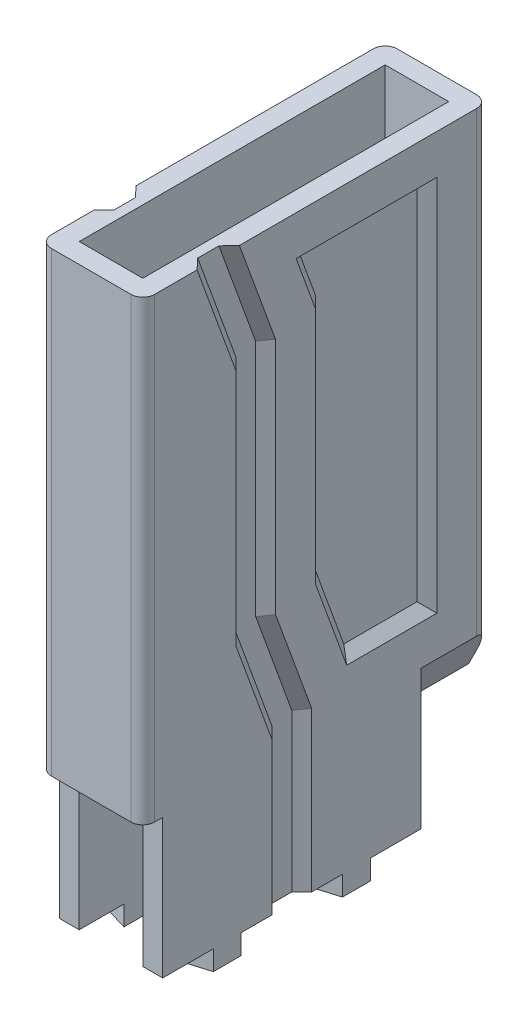
from build123d import *

# Parameters (mm, degrees)
BOSS_EXTRUDE1_DEPTH      = 5
BOSS_EXTRUDE1_2_DEPTH    = 5
BOSS_EXTRUDE1_3_DEPTH    = 5
BOSS_EXTRUDE1_4_DEPTH    = 5
SKETCH5_W                = 5
SKETCH5_H                = 65
BOSS_EXTRUDE6_DEPTH      = 150
SKETCH6_W                = 5
SKETCH6_H                = 125
BOSS_EXTRUDE7_DEPTH      = 12
SKETCH9_W                = 26
SKETCH9_H                = 125
BOSS_EXTRUDE9_DEPTH      = 5
SKETCH7_W                = 26
SKETCH7_H                = 115
BOSS_EXTRUDE8_DEPTH      = 5
CHAMFER1_SIZE            = 10
CHAMFER1_SIZE2           = 5
CHAMFER2_SIZE2           = 10
CHAMFER2_SIZE            = 5
FILLET1_R                = 3
CUT_EXTRUDE2_DEPTH       = 2.5
CUT_EXTRUDE3_DEPTH       = 2.5
CHAMFER3_SIZE            = 2.5
CHAMFER3_OF_MIRROR1_SIZE = 2.5


with BuildPart() as part:
    # Sketch1 → Boss-Extrude1 (new body)
    with BuildSketch(Plane(origin=(0, 0, 0), x_dir=(1, 0, 0), z_dir=(0, 1, 0))):
        Polygon((-13, 19.75), (-13, 12.75), (-8, 11.25), (-8, 21.25), align=None)
    extrude(amount=-BOSS_EXTRUDE1_DEPTH)



with BuildPart() as body_2:
    # Sketch1 → Boss-Extrude1 2 (new body)
    with BuildSketch(Plane(origin=(0, 0, 0), x_dir=(1, 0, 0), z_dir=(0, 1, 0))):
        Polygon((-13, -19.75), (-8, -21.25), (-8, -11.25), (-13, -12.75), align=None)
    extrude(amount=-BOSS_EXTRUDE1_2_DEPTH)


with BuildPart() as body_3:
    # Sketch1 → Boss-Extrude1 3 (new body)
    with BuildSketch(Plane(origin=(0, 0, 0), x_dir=(1, 0, 0), z_dir=(0, 1, 0))):
        Polygon((13, 19.75), (8, 21.25), (8, 11.25), (13, 12.75), align=None)
    extrude(amount=-BOSS_EXTRUDE1_3_DEPTH)


with BuildPart() as body_4:
    # Sketch1 → Boss-Extrude1 4 (new body)
    with BuildSketch(Plane(origin=(0, 0, 0), x_dir=(1, 0, 0), z_dir=(0, 1, 0))):
        Polygon((13, -19.75), (13, -12.75), (8, -11.25), (8, -21.25), align=None)
    extrude(amount=-BOSS_EXTRUDE1_4_DEPTH)


with BuildPart() as part_1:
    add(part.part)

    add(body_2.part)  # Boss-Extrude6 merges body 2

    add(body_3.part)  # Boss-Extrude6 merges body 3

    add(body_4.part)  # Boss-Extrude6 merges body 4
    # Sketch5 → Boss-Extrude6 (add)
    with BuildSketch(Plane(origin=(0, 0, 0), x_dir=(1, 0, 0), z_dir=(0, 1, 0))):
        with Locations((-10.5, 0)):
            Rectangle(SKETCH5_W, SKETCH5_H)
        with Locations((10.5, 0)):
            Rectangle(SKETCH5_W, SKETCH5_H)
    extrude(amount=BOSS_EXTRUDE6_DEPTH)

    # Sketch6 → Boss-Extrude7 (add)
    with BuildSketch(Plane(origin=(0, 0, -32.5), x_dir=(-1, 0, 0), z_dir=(0, 0, -1))):
        with Locations((-10.5, 87.5)):
            Rectangle(SKETCH6_W, SKETCH6_H)
        with Locations((10.5, 87.5)):
            Rectangle(SKETCH6_W, SKETCH6_H)
    extrude(amount=BOSS_EXTRUDE7_DEPTH)

    # Sketch9 → Boss-Extrude9 (add)
    with BuildSketch(Plane(origin=(0, 0, -44.5), x_dir=(-1, 0, 0), z_dir=(0, 0, -1))):
        with Locations((0, 87.5)):
            Rectangle(SKETCH9_W, SKETCH9_H)
    extrude(amount=BOSS_EXTRUDE9_DEPTH)

    # Sketch7 → Boss-Extrude8 (add)
    with BuildSketch(Plane.XY.offset(32.5)):
        with Locations((0, 92.5)):
            Rectangle(SKETCH7_W, SKETCH7_H)
    extrude(amount=BOSS_EXTRUDE8_DEPTH)

    # Chamfer1
    chamfer1_edges = [part_1.edges().sort_by_distance(p)[0] for p in [
        (13, 25, -41),
    ]]
    chamfer1_side = [part_1.faces().sort_by_distance(p)[0] for p in [
        (13, 77.49201278, -5.3514377),
    ]]
    chamfer(chamfer1_edges, length=CHAMFER1_SIZE, length2=CHAMFER1_SIZE2, reference=chamfer1_side[0])

    # Chamfer2
    chamfer2_edges = [part_1.edges().sort_by_distance(p)[0] for p in [
        (-13, 25, -41),
    ]]
    chamfer2_side = [part_1.faces().sort_by_distance(p)[0] for p in [
        (-12.9, 25, -41),
    ]]
    chamfer(chamfer2_edges, length=CHAMFER2_SIZE - 0.0001, length2=CHAMFER2_SIZE2 - 0.0001, reference=chamfer2_side[0])  # a hair under: the kernel refuses the full size

    # Fillet1
    fillet1_edges = [part_1.edges().sort_by_distance(p)[0] for p in [
        (-13, 92.49995, -49.5),
        (13, 92.5, -49.5),
        (13, 92.5, 37.5),
        (-13, 92.5, 37.5),
    ]]
    fillet(fillet1_edges, radius=FILLET1_R)

    # Sketch13 → Cut-Extrude2 (cut)
    with BuildSketch(Plane.ZY.offset(13)):
        Polygon((13.198511713, 150), (4.099255857, 125), (4.099255857, 65), (-5, 40), (-5, 0), (5, 0), (5, 38.236730193), (14.099255857, 63.236730193), (14.099255857, 123.236730193), (23.840289438, 150), align=None)
    cut_extrude2 = extrude(amount=-CUT_EXTRUDE2_DEPTH, mode=Mode.SUBTRACT)

    # Sketch15 → Cut-Extrude3 (cut)
    with BuildSketch(Plane.ZY.offset(13)):
        Polygon((-5.900744143, 66.763269807), (-13.821926553, 45), (-36.5, 45), (-36.5, 140), (-1.082968354, 140), (-5.900744143, 126.763269807), align=None)
    cut_extrude3 = extrude(amount=-CUT_EXTRUDE3_DEPTH, mode=Mode.SUBTRACT)

    # Chamfer3
    chamfer3_edges = [part_1.edges().sort_by_distance(p)[0] for p in [
        (-10.5, 136.618365096, 18.969772647),
        (-10.5, 93.236730193, 14.099255857),
        (-10.5, 50.736730193, 9.549627928),
        (-10.5, 19.118365096, 5),
        (-10.5, 20, -5),
        (-10.5, 52.5, -0.450372072),
        (-10.5, 95, 4.099255857),
        (-10.5, 137.5, 8.648883785),
        (-10.5, 45, -25.160963277),
        (-10.5, 55.881634904, -9.861335348),
        (-10.5, 96.763269807, -5.900744143),
        (-10.5, 133.381634904, -3.491856249),
        (-10.5, 92.5, -36.5),
        (-10.5, 140, -18.791484177),
    ]]
    chamfer(chamfer3_edges, length=CHAMFER3_SIZE - 0.0001)  # a hair under: the kernel refuses the full size

    # Mirror1: Cut-Extrude2, Cut-Extrude3 across plane
    add(cut_extrude2.mirror(Plane(origin=(0, 0, 0), x_dir=(0, 0, 1), z_dir=(1, 0, 0))), mode=Mode.SUBTRACT)
    add(cut_extrude3.mirror(Plane(origin=(0, 0, 0), x_dir=(0, 0, 1), z_dir=(1, 0, 0))), mode=Mode.SUBTRACT)

    # Chamfer3 of Mirror1
    chamfer3_of_mirror1_edges = [part_1.edges().sort_by_distance(p)[0] for p in [
        (10.5, 136.618365096, 18.969772647),
        (10.5, 93.236730193, 14.099255857),
        (10.5, 50.736730193, 9.549627928),
        (10.5, 19.118365096, 5),
        (10.5, 20, -5),
        (10.5, 52.5, -0.450372072),
        (10.5, 95, 4.099255857),
        (10.5, 137.5, 8.648883785),
        (10.5, 45, -25.160963277),
        (10.5, 55.881634904, -9.861335348),
        (10.5, 96.763269807, -5.900744143),
        (10.5, 133.381634904, -3.491856249),
        (10.5, 92.5, -36.5),
        (10.5, 140, -18.791484177),
    ]]
    chamfer(chamfer3_of_mirror1_edges, length=CHAMFER3_OF_MIRROR1_SIZE - 0.0001)  # a hair under: the kernel refuses the full size


solid = part_1.part
